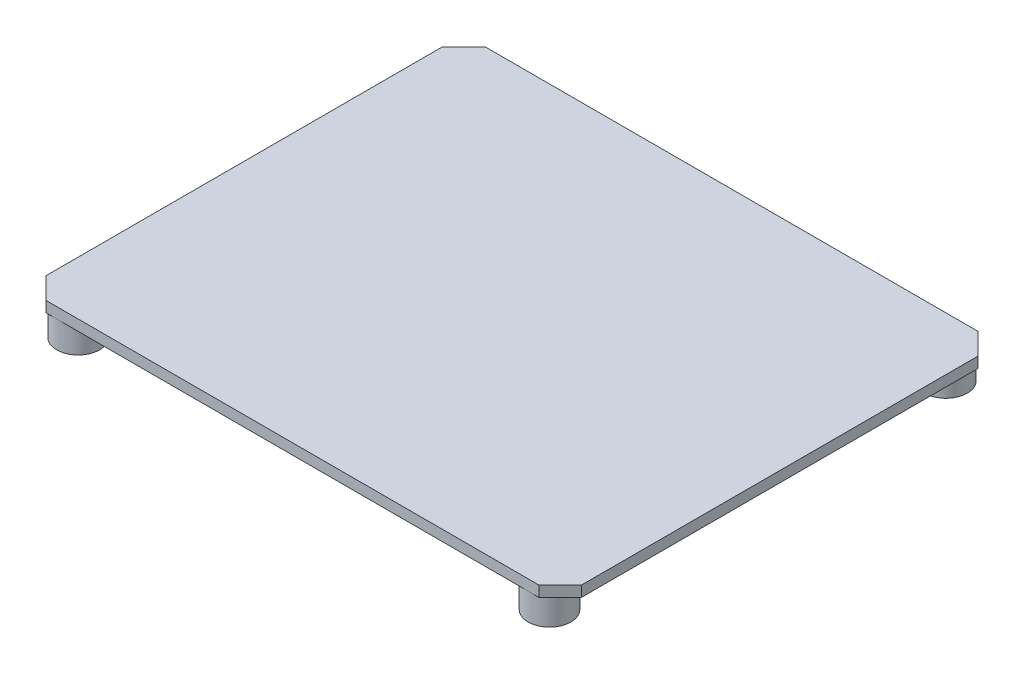
from build123d import *

# Parameters (mm, degrees)
SHADE_PLATE_DEPTH = 2
SKETCH2_R         = 4
POSTS_DEPTH       = 5.1
SKETCH3_R         = 1.25
POST_PILOTS_DEPTH = 6.5


with BuildPart() as part:
    # Sketch1 → Shade Plate (new body)
    with BuildSketch(Plane(origin=(0, 35.4, 0), x_dir=(1, 0, 0), z_dir=(0, 1, 0))):
        Polygon((-46, -102), (46, -102), (50, -98), (50, -24), (46, -20), (-46, -20), (-50, -24), (-50, -98), align=None)
    extrude(amount=SHADE_PLATE_DEPTH)

    # Sketch2 → Posts (add)
    with BuildSketch(Plane(origin=(0, 30.4, 0), x_dir=(1, 0, 0), z_dir=(0, 1, 0))):
        with Locations((-44, -24)):
            Circle(SKETCH2_R)
        with Locations((-44, -98)):
            Circle(SKETCH2_R)
        with Locations((44, -24)):
            Circle(SKETCH2_R)
        with Locations((44, -98)):
            Circle(SKETCH2_R)
    extrude(amount=POSTS_DEPTH)

    # Sketch3 → Post Pilots (cut)
    with BuildSketch(Plane(origin=(0, 29.9, 0), x_dir=(1, 0, 0), z_dir=(0, 1, 0))):
        with Locations((-44, -24)):
            Circle(SKETCH3_R)
        with Locations((-44, -98)):
            Circle(SKETCH3_R)
        with Locations((44, -24)):
            Circle(SKETCH3_R)
        with Locations((44, -98)):
            Circle(SKETCH3_R)
    extrude(amount=POST_PILOTS_DEPTH, mode=Mode.SUBTRACT)


solid = part.part
